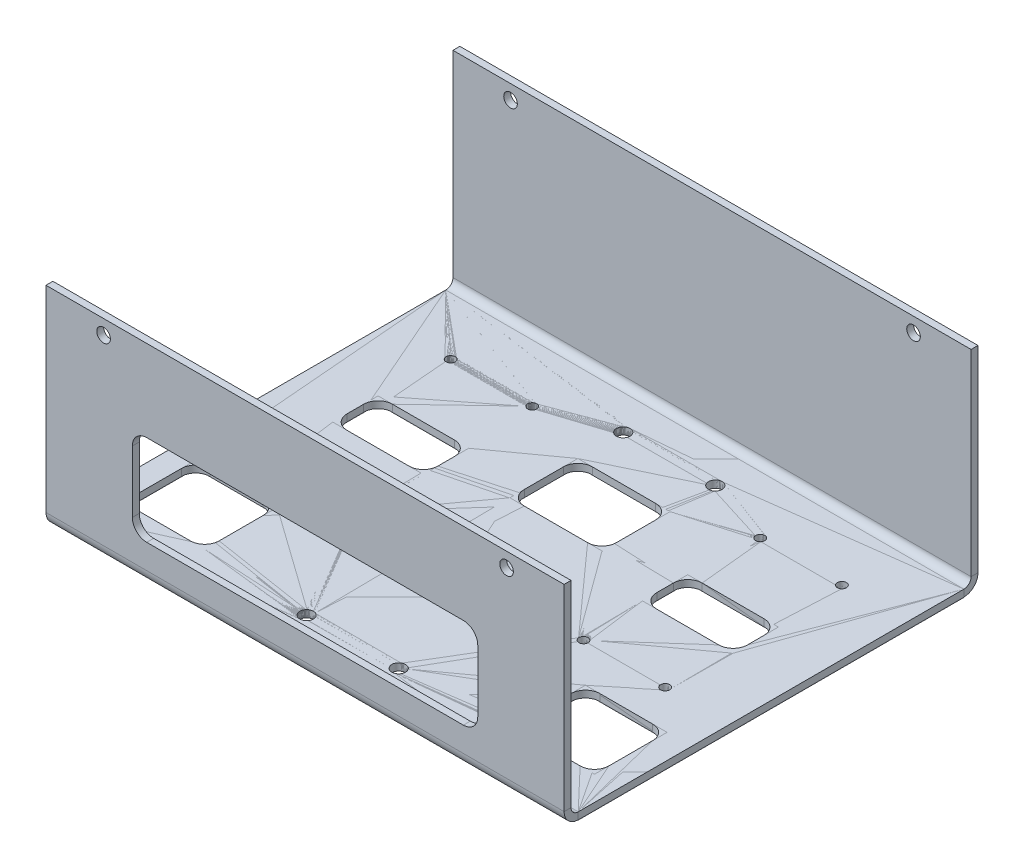
from build123d import *

# Parameters (mm, degrees)
ESQUISSE1_W                       = 114.3
ESQUISSE1_H                       = 85.08
ESQUISSE1_R                       = 1.5
ESQUISSE1_R_2                     = 1
ESQUISSE1_W_2                     = 20
ESQUISSE1_H_2                     = 10
ESQUISSE1_W_3                     = 18
ESQUISSE1_H_3                     = 16
ESQUISSE1_W_4                     = 20.32
ESQUISSE1_H_4                     = 15
BOSS_EXTRU_1_DEPTH                = 1.5875
CONVERTIR_VOLUME1_START           = 0.0635
CONVERTIR_VOLUME1_OUTLINE_W       = 114.3
CONVERTIR_VOLUME1_OUTLINE_H       = 85.08
CONVERTIR_VOLUME1_OUTLINE_W_2     = 18
CONVERTIR_VOLUME1_OUTLINE_H_2     = 16
CONVERTIR_VOLUME1_OUTLINE_R       = 1.5
CONVERTIR_VOLUME1_OUTLINE_R_2     = 1
CONVERTIR_VOLUME1_OUTLINE_W_3     = 20
CONVERTIR_VOLUME1_OUTLINE_H_3     = 10
CONVERTIR_VOLUME1_OUTLINE_W_4     = 20.32
CONVERTIR_VOLUME1_OUTLINE_H_4     = 15
CONVERTIR_VOLUME1_DEPTH           = 1.524
T_LE_PLI_E_SUR_AR_TE1_DEPTH       = 114.3
T_LE_START                        = 1.524
T_LE_PLI_E_SUR_AR_TE1_PROFILE_W   = 114.3
T_LE_PLI_E_SUR_AR_TE1_PROFILE_H   = 43.4125
T_LE_PLI_E_SUR_AR_TE1_PROFILE_W_2 = 76.2
T_LE_PLI_E_SUR_AR_TE1_PROFILE_H_2 = 20
T_LE_PLI_E_SUR_AR_TE1_PROFILE_R   = 1.5
T_LE_PLI_E_SUR_AR_TE1_FLAT_DEPTH  = 1.524
T_LE_PLI_E_SUR_AR_TE2_DEPTH       = 114.3
T_LE_PLI_E_SUR_AR_TE2_PROFILE_W   = 114.3
T_LE_PLI_E_SUR_AR_TE2_PROFILE_H   = 43.4125
T_LE_PLI_E_SUR_AR_TE2_PROFILE_R   = 1.5
T_LE_PLI_E_SUR_AR_TE2_FLAT_DEPTH  = 1.524
CONG_4_R                          = 3.175


with BuildPart() as part:
    # Esquisse1 → Boss.-Extru.1 (new body)
    with BuildSketch(Plane(origin=(0, 0, 0), x_dir=(1, 0, 0), z_dir=(0, 1, 0))):
        with Locations((52.157727273, 37.47)):
            Rectangle(ESQUISSE1_W, ESQUISSE1_H)
        with Locations(Location((62.092433155, 72.39, 0), (0, 0, 270))):
            Circle(ESQUISSE1_R, mode=Mode.SUBTRACT)
        with Locations(Location((62.092433155, 2.54, 0), (0, 0, 270))):
            Circle(ESQUISSE1_R, mode=Mode.SUBTRACT)
        with Locations(Location((77.092433155, 67.31, 0), (0, 0, 270))):
            Circle(ESQUISSE1_R_2, mode=Mode.SUBTRACT)
        with Locations(Location((95.092433155, 67.31, 0), (0, 0, 270))):
            Circle(ESQUISSE1_R_2, mode=Mode.SUBTRACT)
        with Locations(Location((95.092433155, 28.31, 0), (0, 0, 270))):
            Circle(ESQUISSE1_R_2, mode=Mode.SUBTRACT)
        with Locations(Location((77.092433155, 28.31, 0), (0, 0, 270))):
            Circle(ESQUISSE1_R_2, mode=Mode.SUBTRACT)
        with Locations(Location((41.772433155, 2.54, 0), (0, 0, 90))):
            Circle(ESQUISSE1_R, mode=Mode.SUBTRACT)
        with Locations(Location((8.772433155, 28.31, 0), (0, 0, 90))):
            Circle(ESQUISSE1_R_2, mode=Mode.SUBTRACT)
        with Locations(Location((26.772433155, 28.31, 0), (0, 0, 90))):
            Circle(ESQUISSE1_R_2, mode=Mode.SUBTRACT)
        with Locations(Location((8.772433155, 67.31, 0), (0, 0, 90))):
            Circle(ESQUISSE1_R_2, mode=Mode.SUBTRACT)
        with Locations(Location((26.772433155, 67.31, 0), (0, 0, 90))):
            Circle(ESQUISSE1_R_2, mode=Mode.SUBTRACT)
        with Locations(Location((41.772433155, 72.39, 0), (0, 0, 90))):
            Circle(ESQUISSE1_R, mode=Mode.SUBTRACT)
        with Locations((17.772433155, 47.31)):
            Rectangle(ESQUISSE1_W_2, ESQUISSE1_H_2, mode=Mode.SUBTRACT)
        with Locations((86.092433155, 47.31)):
            Rectangle(ESQUISSE1_W_2, ESQUISSE1_H_2, mode=Mode.SUBTRACT)
        with Locations((8.941564399, 11.906027524)):
            Rectangle(ESQUISSE1_W_3, ESQUISSE1_H_3, mode=Mode.SUBTRACT)
        with Locations((51.932433155, 54.89)):
            Rectangle(ESQUISSE1_W_4, ESQUISSE1_H_4, mode=Mode.SUBTRACT)
        with Locations((94.923301911, 11.906027524)):
            Rectangle(ESQUISSE1_W_3, ESQUISSE1_H_3, mode=Mode.SUBTRACT)
    extrude(amount=BOSS_EXTRU_1_DEPTH)


with BuildPart() as body_2:
    # Convertir-Volume1: read off the stored shape, not the designer's step
    # Convertir-Volume1 outline → Convertir-Volume1 (new body)
    with BuildSketch(Plane(origin=(0, 0, 0), x_dir=(1, 0, 0), z_dir=(0, 1, 0)).offset(CONVERTIR_VOLUME1_START)):
        with Locations((52.157727273, 37.47)):
            Rectangle(CONVERTIR_VOLUME1_OUTLINE_W, CONVERTIR_VOLUME1_OUTLINE_H)
        with Locations((8.941564399, 11.906027524)):
            Rectangle(CONVERTIR_VOLUME1_OUTLINE_W_2, CONVERTIR_VOLUME1_OUTLINE_H_2, mode=Mode.SUBTRACT)
        with Locations((41.772433155, 2.54)):
            Circle(CONVERTIR_VOLUME1_OUTLINE_R, mode=Mode.SUBTRACT)
        with Locations((8.772433155, 28.31)):
            Circle(CONVERTIR_VOLUME1_OUTLINE_R_2, mode=Mode.SUBTRACT)
        with Locations((26.772433155, 28.31)):
            Circle(CONVERTIR_VOLUME1_OUTLINE_R_2, mode=Mode.SUBTRACT)
        with Locations((62.092433155, 2.54)):
            Circle(CONVERTIR_VOLUME1_OUTLINE_R, mode=Mode.SUBTRACT)
        with Locations((94.923301911, 11.906027524)):
            Rectangle(CONVERTIR_VOLUME1_OUTLINE_W_2, CONVERTIR_VOLUME1_OUTLINE_H_2, mode=Mode.SUBTRACT)
        with Locations((77.092433155, 28.31)):
            Circle(CONVERTIR_VOLUME1_OUTLINE_R_2, mode=Mode.SUBTRACT)
        with Locations((95.092433155, 28.31)):
            Circle(CONVERTIR_VOLUME1_OUTLINE_R_2, mode=Mode.SUBTRACT)
        with Locations((17.772433155, 47.31)):
            Rectangle(CONVERTIR_VOLUME1_OUTLINE_W_3, CONVERTIR_VOLUME1_OUTLINE_H_3, mode=Mode.SUBTRACT)
        with Locations((51.932433155, 54.89)):
            Rectangle(CONVERTIR_VOLUME1_OUTLINE_W_4, CONVERTIR_VOLUME1_OUTLINE_H_4, mode=Mode.SUBTRACT)
        with Locations((8.772433155, 67.31)):
            Circle(CONVERTIR_VOLUME1_OUTLINE_R_2, mode=Mode.SUBTRACT)
        with Locations((26.772433155, 67.31)):
            Circle(CONVERTIR_VOLUME1_OUTLINE_R_2, mode=Mode.SUBTRACT)
        with Locations((41.772433155, 72.39)):
            Circle(CONVERTIR_VOLUME1_OUTLINE_R, mode=Mode.SUBTRACT)
        with Locations((86.092433155, 47.31)):
            Rectangle(CONVERTIR_VOLUME1_OUTLINE_W_3, CONVERTIR_VOLUME1_OUTLINE_H_3, mode=Mode.SUBTRACT)
        with Locations((77.092433155, 67.31)):
            Circle(CONVERTIR_VOLUME1_OUTLINE_R_2, mode=Mode.SUBTRACT)
        with Locations((62.092433155, 72.39)):
            Circle(CONVERTIR_VOLUME1_OUTLINE_R, mode=Mode.SUBTRACT)
        with Locations((95.092433155, 67.31)):
            Circle(CONVERTIR_VOLUME1_OUTLINE_R_2, mode=Mode.SUBTRACT)
    extrude(amount=CONVERTIR_VOLUME1_DEPTH)

    # Tôle pliée sur arête1: sheet metal written as solids
    # Tôle pliée sur arête1 bend section (on a plane across the edge) → Tôle pliée sur arête1 (add)
    with BuildSketch(Plane(origin=(-4.992272727, 1.5875, 6.6575), x_dir=(0, 0, -1), z_dir=(1, 0, 0))):
        with BuildLine():
            Line((-1.524, 1.5875), (0, 1.5875))
            ThreePointArc((0, 1.5875), (0.464967985, 0.464967985), (1.5875, 0))
            Line((1.5875, 0), (1.5875, -1.524))
            ThreePointArc((1.5875, -1.524), (-0.61266275, -0.61266275), (-1.524, 1.5875))
        make_face()
    extrude(amount=T_LE_PLI_E_SUR_AR_TE1_DEPTH)

    # Tôle pliée sur arête1 profile (on flange) → Tôle pliée sur arête1 flat (add)
    with BuildSketch(Plane(origin=(0, 1.5875, 6.6575), x_dir=(1, 0, 0), z_dir=(0, 0, 1)).offset(T_LE_START)):
        with Locations((52.157727273, 23.29375)):
            Rectangle(T_LE_PLI_E_SUR_AR_TE1_PROFILE_W, T_LE_PLI_E_SUR_AR_TE1_PROFILE_H)
        with Locations((52.157727273, 17)):
            Rectangle(T_LE_PLI_E_SUR_AR_TE1_PROFILE_W_2, T_LE_PLI_E_SUR_AR_TE1_PROFILE_H_2, mode=Mode.SUBTRACT)
        with Locations((7.707727273, 41.825)):
            Circle(T_LE_PLI_E_SUR_AR_TE1_PROFILE_R, mode=Mode.SUBTRACT)
        with Locations((96.607727273, 41.825)):
            Circle(T_LE_PLI_E_SUR_AR_TE1_PROFILE_R, mode=Mode.SUBTRACT)
    extrude(amount=-T_LE_PLI_E_SUR_AR_TE1_FLAT_DEPTH)

    # Tôle pliée sur arête2: sheet metal written as solids
    # Tôle pliée sur arête2 bend section (on a plane across the edge) → Tôle pliée sur arête2 (add)
    with BuildSketch(Plane(origin=(109.307727273, 1.5875, -81.5975), x_dir=(0, 0, 1), z_dir=(-1, 0, 0))):
        with BuildLine():
            Line((-1.524, 1.5875), (0, 1.5875))
            ThreePointArc((0, 1.5875), (0.464967985, 0.464967985), (1.5875, 0))
            Line((1.5875, 0), (1.5875, -1.524))
            ThreePointArc((1.5875, -1.524), (-0.61266275, -0.61266275), (-1.524, 1.5875))
        make_face()
    extrude(amount=T_LE_PLI_E_SUR_AR_TE2_DEPTH)

    # Tôle pliée sur arête2 profile (on flange) → Tôle pliée sur arête2 flat (add)
    with BuildSketch(Plane(origin=(0, 1.5875, -81.5975), x_dir=(-1, 0, 0), z_dir=(0, 0, -1)).offset(T_LE_START)):
        with Locations((-52.157727273, 23.29375)):
            Rectangle(T_LE_PLI_E_SUR_AR_TE2_PROFILE_W, T_LE_PLI_E_SUR_AR_TE2_PROFILE_H)
        with Locations((-7.707727273, 41.825)):
            Circle(T_LE_PLI_E_SUR_AR_TE2_PROFILE_R, mode=Mode.SUBTRACT)
        with Locations((-96.607727273, 41.825)):
            Circle(T_LE_PLI_E_SUR_AR_TE2_PROFILE_R, mode=Mode.SUBTRACT)
    extrude(amount=-T_LE_PLI_E_SUR_AR_TE2_FLAT_DEPTH)

    # Congé4
    cong_4_edges = [body_2.edges().sort_by_distance(p)[0] for p in [
        (103.923301911, 0.8255, -19.906027524),
        (85.923301911, 0.8255, -19.906027524),
        (85.923301911, 0.8255, -3.906027524),
        (103.923301911, 0.8255, -3.906027524),
        (7.772433155, 0.8255, -52.31),
        (7.772433155, 0.8255, -42.31),
        (27.772433155, 0.8255, -42.31),
        (27.772433155, 0.8255, -52.31),
        (96.092433155, 0.8255, -52.31),
        (76.092433155, 0.8255, -52.31),
        (76.092433155, 0.8255, -42.31),
        (96.092433155, 0.8255, -42.31),
        (62.092433155, 0.8255, -62.39),
        (41.772433155, 0.8255, -62.39),
        (41.772433155, 0.8255, -47.39),
        (62.092433155, 0.8255, -47.39),
        (-0.058435601, 0.8255, -19.906027524),
        (-0.058435601, 0.8255, -3.906027524),
        (17.941564399, 0.8255, -3.906027524),
        (17.941564399, 0.8255, -19.906027524),
        (14.057727273, 8.5875, 7.4195),
        (90.257727273, 8.5875, 7.4195),
        (90.257727273, 28.5875, 7.4195),
        (14.057727273, 28.5875, 7.4195),
    ]]
    fillet(cong_4_edges, radius=CONG_4_R)


solid = Compound([part.part, body_2.part])
